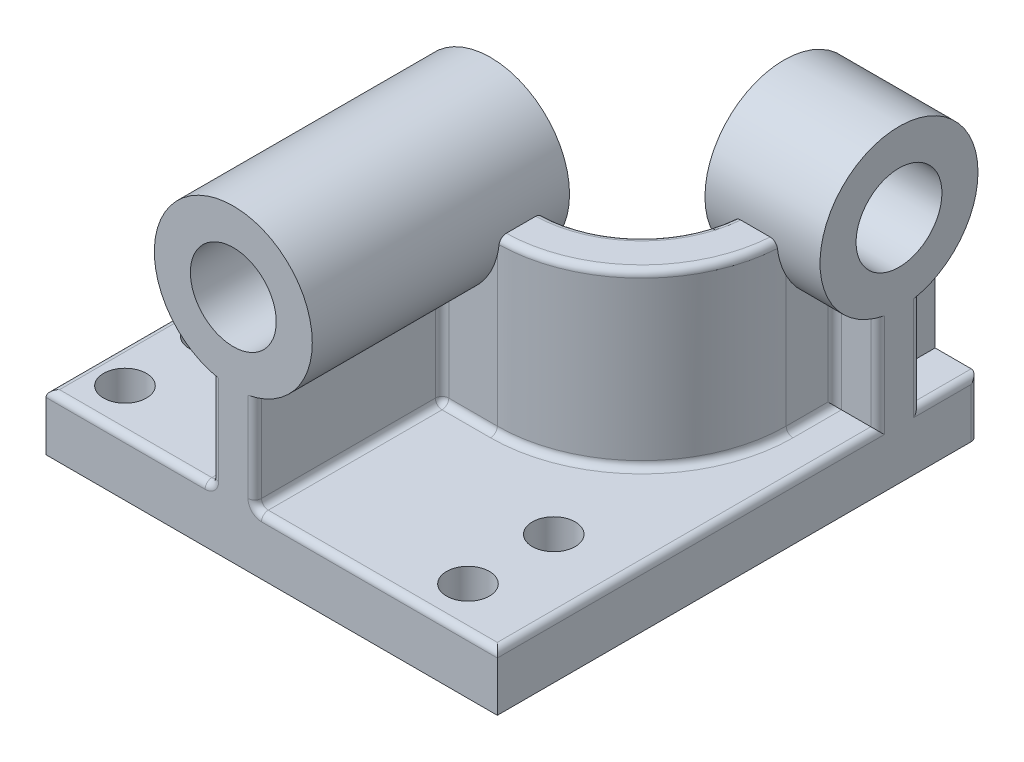
from build123d import *

# Parameters (mm, degrees)
BOSS_EXTRUDE2_DEPTH = 25
FILLET1_R           = 45
SKETCH7_R           = 35
SKETCH7_R_2         = 19.025
BOSS_EXTRUDE3_DEPTH = 114
SKETCH8_R           = 35
SKETCH8_R_2         = 19.025
BOSS_EXTRUDE4_DEPTH = 51
BOSS_EXTRUDE5_START = 76
BOSS_EXTRUDE5_DEPTH = 76
SKETCH8_2_R         = 19.025
CUT_EXTRUDE1_DEPTH  = 265.785290469
SKETCH7_2_R         = 19.025
CUT_EXTRUDE2_DEPTH  = 273.282941239
BOSS_EXTRUDE6_REACH = 274.283
BOSS_EXTRUDE7_REACH = 266.785
SKETCH12_R          = 9.5
CUT_EXTRUDE3_DEPTH  = 185.082182907
FILLET2_R           = 3


with BuildPart() as part:
    # Sketch2 → Boss-Extrude2 (new body)
    with BuildSketch(Plane(origin=(0, 0, 0), x_dir=(1, 0, 0), z_dir=(0, 1, 0))):
        Polygon((-100, -106.5), (-100, -4.5), (62, -4.5), (62, 106.5), (100, 106.5), (100, -106.5), align=None)
    extrude(amount=BOSS_EXTRUDE2_DEPTH)

    # Fillet1
    fillet1_edges = [part.edges().sort_by_distance(p)[0] for p in [
        (62, 12.5, 4.5),
    ]]
    fillet(fillet1_edges, radius=FILLET1_R)



with BuildPart() as body_2:
    # Sketch7 → Boss-Extrude3 (new body)
    with BuildSketch(Plane.XY.offset(106.5)):
        with Locations((-17, 102)):
            Circle(SKETCH7_R)
        with Locations((-17, 102)):
            Circle(SKETCH7_R_2, mode=Mode.SUBTRACT)
    extrude(amount=-BOSS_EXTRUDE3_DEPTH)


with BuildPart() as body_3:
    # Sketch8 → Boss-Extrude4 (new body)
    with BuildSketch(Plane(origin=(100, 0, 0), x_dir=(0, 0, -1), z_dir=(1, 0, 0))):
        with Locations((71.5, 102)):
            Circle(SKETCH8_R)
        with Locations((71.5, 102)):
            Circle(SKETCH8_R_2, mode=Mode.SUBTRACT)
    extrude(amount=-BOSS_EXTRUDE4_DEPTH)


with BuildPart() as part_1:
    add(part.part)

    add(body_2.part)  # Boss-Extrude5 merges body 2

    add(body_3.part)  # Boss-Extrude5 merges body 3
    # Sketch9 → Boss-Extrude5 (add)
    with BuildSketch(Plane(origin=(0, 25, 0), x_dir=(1, 0, 0), z_dir=(0, 1, 0)).offset(BOSS_EXTRUDE5_START)):
        with BuildLine():
            Line((17, -4.5), (-52, -4.5))
            Line((-52, -4.5), (-52, -23.5))
            Line((-52, -23.5), (17, -23.5))
            ThreePointArc((17, -23.5), (62.254833996, -4.754833996), (81, 40.5))
            Line((81, 40.5), (81, 106.5))
            Line((81, 106.5), (62, 106.5))
            Line((62, 106.5), (62, 40.5))
            ThreePointArc((62, 40.5), (48.819805153, 8.680194847), (17, -4.5))
        make_face()
    extrude(amount=-BOSS_EXTRUDE5_DEPTH)

    # Sketch8<2> → Cut-Extrude1 (cut, through all)
    with BuildSketch(Plane(origin=(100, 0, 0), x_dir=(0, 0, -1), z_dir=(1, 0, 0))):
        with Locations((71.5, 102)):
            Circle(SKETCH8_2_R)
    extrude(amount=-CUT_EXTRUDE1_DEPTH, mode=Mode.SUBTRACT)

    # Sketch7<2> → Cut-Extrude2 (cut, through all)
    with BuildSketch(Plane.XY.offset(106.5)):
        with Locations((-17, 102)):
            Circle(SKETCH7_2_R)
    extrude(amount=-CUT_EXTRUDE2_DEPTH, mode=Mode.SUBTRACT)

    # Sketch10 → Boss-Extrude6 (add, up to next)
    with BuildSketch(Plane.XY.offset(106.5), mode=Mode.PRIVATE) as boss_extrude6_sk1:
        with BuildLine():
            Line((-26.5, 25), (-7.5, 25))
            Line((-7.5, 25), (-7.5, 68.313949475))
            ThreePointArc((-7.5, 68.313949475), (-17, 67), (-26.5, 68.313949475))
            Line((-26.5, 68.313949475), (-26.5, 25))
        make_face()
    boss_extrude6_tool1 = extrude(boss_extrude6_sk1.sketch, amount=-BOSS_EXTRUDE6_REACH, mode=Mode.PRIVATE) - part_1.part
    add(boss_extrude6_tool1.solids().sort_by_distance((-17, 46.219119, 106.5))[0])

    # Sketch11 → Boss-Extrude7 (add, up to next)
    with BuildSketch(Plane(origin=(100, 0, 0), x_dir=(0, 0, -1), z_dir=(1, 0, 0)), mode=Mode.PRIVATE) as boss_extrude7_sk1:
        with BuildLine():
            Line((62, 25), (81, 25))
            Line((81, 25), (81, 68.313949475))
            ThreePointArc((81, 68.313949475), (71.5, 67), (62, 68.313949475))
            Line((62, 68.313949475), (62, 25))
        make_face()
    boss_extrude7_tool1 = extrude(boss_extrude7_sk1.sketch, amount=-BOSS_EXTRUDE7_REACH, mode=Mode.PRIVATE) - part_1.part
    add(boss_extrude7_tool1.solids().sort_by_distance((100, 46.219119, -71.5))[0])

    # Sketch12 → Cut-Extrude3 (cut, through all)
    with BuildSketch(Plane(origin=(0, 25, 0), x_dir=(1, 0, 0), z_dir=(0, 1, 0))):
        with Locations((68, -49.5)):
            Circle(SKETCH12_R)
        with Locations((68, -87.5)):
            Circle(SKETCH12_R)
        with Locations((-84, -49.5)):
            Circle(SKETCH12_R)
        with Locations((-84, -87.5)):
            Circle(SKETCH12_R)
    extrude(amount=-CUT_EXTRUDE3_DEPTH, mode=Mode.SUBTRACT)

    # Fillet2
    fillet2_edges = [part_1.edges().sort_by_distance(p)[0] for p in [
        (-52, 63, 4.5),
        (-7.5, 46.656974737, 106.5),
        (4.75, 25, 23.5),
        (81, 25, -51.25),
        (47.739784514, 101, -7.635647762),
        (-26.5, 25, 65),
        (-52, 25, 14),
        (-39.25, 25, 23.5),
        (-26.5, 46.656974737, 23.5),
        (-76, 25, 4.5),
        (-100, 25, 55.5),
        (-63.25, 25, 106.5),
        (-7.5, 46.656974737, 23.5),
        (81, 46.656974737, -81),
        (81, 46.656974737, -62),
        (100, 12.5, -106.5),
        (100, 25, -93.75),
        (100, 46.656974737, -81),
        (100, 46.656974737, -62),
        (61.180922368, 101, 5.803845399),
        (-26.5, 46.656974737, 106.5),
        (100, 25, 22.25),
        (46.25, 25, 106.5),
        (-7.5, 25, 65),
        (62.254833996, 25, 4.754833996),
    ]]
    fillet(fillet2_edges, radius=FILLET2_R)


solid = part_1.part
